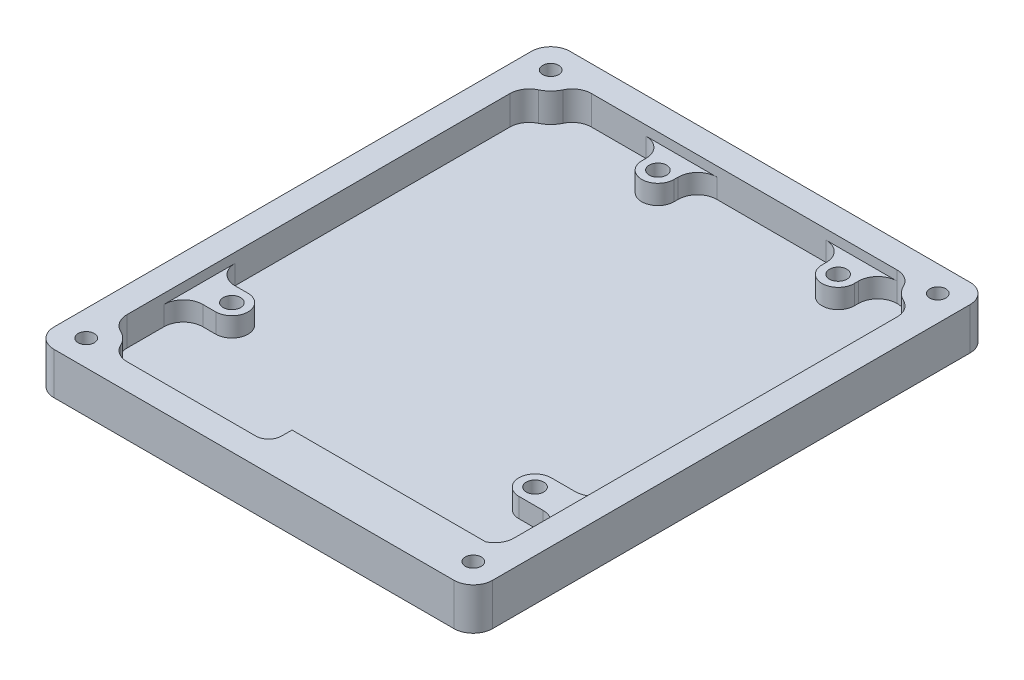
from build123d import *

# Parameters (mm, degrees)
EXTRUDE_1_DEPTH     = 7.5
EXTRUDE_2_DEPTH     = 3
EXTRUDE_3_DEPTH     = 3
FILLET_3_R          = 3
EXTRUDE_4_REACH     = 55.031
SKETCH_5_W          = 30
SKETCH_5_H          = 4.5
SKETCH_8_R          = 1.25
CUT_EXTRUDE_2_DEPTH = 5
CHAMFER_1_SIZE      = 1
CHAMFER_1_SIZE_2    = 3
CUT_EXTRUDE_4_DEPTH = 0.1
CUT_EXTRUDE_3_DEPTH = 0.2
SKETCH_20_R         = 1.35
CUT_EXTRUDE_5_DEPTH = 5
FILLET_4_R          = 2


with BuildPart() as part:
    # 스케치1 → 보스-돌출1 (new body)
    with BuildSketch(Plane(origin=(0, 0, 0), x_dir=(1, 0, 0), z_dir=(0, 1, 0))):
        with BuildLine():
            Line((-34, 37), (-34, -37))
            ThreePointArc((-34, -37), (-33.121320344, -39.121320344), (-31, -40))
            Line((-31, -40), (31, -40))
            ThreePointArc((31, -40), (33.121320344, -39.121320344), (34, -37))
            Line((34, -37), (34, 37))
            ThreePointArc((34, 37), (33.121320344, 39.121320344), (31, 40))
            Line((31, 40), (-31, 40))
            ThreePointArc((-31, 40), (-33.121320344, 39.121320344), (-34, 37))
        make_face()
        with BuildLine():
            Line((-26, 36), (26, 36))
            ThreePointArc((26, 36), (27.171572875, 33.171572875), (30, 32))
            Line((30, 32), (30, -32))
            ThreePointArc((30, -32), (27.171572875, -33.171572875), (26, -36))
            Line((26, -36), (-26, -36))
            ThreePointArc((-26, -36), (-27.171572875, -33.171572875), (-30, -32))
            Line((-30, -32), (-30, 32))
            ThreePointArc((-30, 32), (-27.171572875, 33.171572875), (-26, 36))
        make_face(mode=Mode.SUBTRACT)
    extrude(amount=EXTRUDE_1_DEPTH)

    # 스케치3 → 보스-돌출2 (add)
    with BuildSketch(Plane.XZ):
        with BuildLine():
            Line((-34, 37), (-34, -37))
            ThreePointArc((-34, -37), (-33.121320344, -39.121320344), (-31, -40))
            Line((-31, -40), (31, -40))
            ThreePointArc((31, -40), (33.121320344, -39.121320344), (34, -37))
            Line((34, -37), (34, 37))
            ThreePointArc((34, 37), (33.121320344, 39.121320344), (31, 40))
            Line((31, 40), (-31, 40))
            ThreePointArc((-31, 40), (-33.121320344, 39.121320344), (-34, 37))
        make_face()
    extrude(amount=-EXTRUDE_2_DEPTH)

    # 스케치4 → 보스-돌출3 (add)
    with BuildSketch(Plane(origin=(0, 3, 0), x_dir=(1, 0, 0), z_dir=(0, 1, 0))):
        with BuildLine():
            Line((23.27542024, -17.206647727), (31.27542024, -17.206647727))
            Line((31.27542024, -17.206647727), (31.27542024, -22.206647727))
            Line((31.27542024, -22.206647727), (23.27542024, -22.206647727))
            ThreePointArc((23.27542024, -22.206647727), (20.77542024, -19.706647727), (23.27542024, -17.206647727))
        make_face()
        with BuildLine():
            Line((-24.98457976, -20.936647727), (-30.98457976, -20.936647727))
            Line((-30.98457976, -20.936647727), (-30.98457976, -15.936647727))
            Line((-30.98457976, -15.936647727), (-24.98457976, -15.936647727))
            ThreePointArc((-24.98457976, -15.936647727), (-22.48457976, -18.436647727), (-24.98457976, -20.936647727))
        make_face()
        with BuildLine():
            Line((15.69542024, 32.363352273), (15.69542024, 38.363352273))
            Line((15.69542024, 38.363352273), (20.69542024, 38.363352273))
            Line((20.69542024, 38.363352273), (20.69542024, 32.363352273))
            ThreePointArc((20.69542024, 32.363352273), (18.19542024, 29.863352273), (15.69542024, 32.363352273))
        make_face()
        with BuildLine():
            Line((-12.24457976, 38.363352273), (-7.24457976, 38.363352273))
            Line((-7.24457976, 38.363352273), (-7.24457976, 32.363352273))
            ThreePointArc((-7.24457976, 32.363352273), (-9.74457976, 29.863352273), (-12.24457976, 32.363352273))
            Line((-12.24457976, 32.363352273), (-12.24457976, 38.363352273))
        make_face()
    extrude(amount=EXTRUDE_3_DEPTH)

    # 필렛3
    # the kernel refuses this fillet: 3 mm, written as the material it adds along each edge
    with BuildSketch(Plane(origin=(30, 3, 17.206647727), x_dir=(0, 0, -1), z_dir=(0, 1, 0)), Plane(origin=(30, 6, 22.206647727), x_dir=(0, 0, 1), z_dir=(0, -1, 0)), Plane(origin=(15.69542024, 3, -36), x_dir=(-1, 0, 0), z_dir=(0, 1, 0)), Plane(origin=(20.69542024, 6, -36), x_dir=(1, 0, 0), z_dir=(0, -1, 0)), Plane(origin=(-7.24457976, 6, -36), x_dir=(1, 0, 0), z_dir=(0, -1, 0)), Plane(origin=(-12.24457976, 3, -36), x_dir=(-1, 0, 0), z_dir=(0, 1, 0)), Plane(origin=(-30, 6, 15.936647727), x_dir=(0, 0, -1), z_dir=(0, -1, 0)), Plane(origin=(-30, 3, 20.936647727), x_dir=(0, 0, 1), z_dir=(0, 1, 0))) as fillet_3_piece_1:
        with BuildLine():
            CenterArc((FILLET_3_R, FILLET_3_R), FILLET_3_R, 180, 90)
            Line((0, FILLET_3_R), (0, 0))
            Line((0, 0), (FILLET_3_R, 0))
        make_face()
    extrude(amount=3)
    with BuildSketch(Plane(origin=(30, 3, -32), x_dir=(-0.9755787776764236, 0, -0.21964983165797128), z_dir=(0, 1, 0)), Plane(origin=(-30, 3, 32), x_dir=(0.9755787776764236, 0, 0.21964983165797128), z_dir=(0, 1, 0)), Plane(origin=(26, 3, 36), x_dir=(0.21964983165797042, 0, -0.9755787776764239), z_dir=(0, 1, 0))) as fillet_3_piece_2:
        with BuildLine():
            CenterArc((2.416148148, 2.926736333), FILLET_3_R, 192.688466763, 64.623066475)
            Line((-0.510588185, 2.267786838), (0, 0))
            ThreePointArc((0, 0), (0.878599327, 0.097684889), (1.757198653, 0))
        make_face()
    extrude(amount=4.5)
    with BuildSketch(Plane(origin=(26, 3, -36), x_dir=(-1, 0, 0), z_dir=(0, 1, 0)), Plane(origin=(-30, 3, -32), x_dir=(0, 0, 1), z_dir=(0, 1, 0)), Plane(origin=(-26, 3, 36), x_dir=(1, 0, 0), z_dir=(0, 1, 0)), Plane(origin=(30, 3, 32), x_dir=(0, 0, -1), z_dir=(0, 1, 0))) as fillet_3_piece_3:
        with BuildLine():
            CenterArc((2.32455532, 3), FILLET_3_R, 205.376933525, 64.623066475)
            ThreePointArc((-0.385968388, 1.714285714), (-0.097684889, 0.878599327), (0, 0))
            Line((0, 0), (2.32455532, 0))
        make_face()
    extrude(amount=4.5)
    with BuildSketch(Plane(origin=(-26, 3, -36), x_dir=(1, 0, 0), z_dir=(0, 1, 0))) as fillet_3_piece_4:
        with BuildLine():
            CenterArc((2.32455532, -3), FILLET_3_R, 90, 64.623066475)
            ThreePointArc((-0.385968388, -1.714285714), (-0.097684889, -0.878599327), (0, 0))
            Line((0, 0), (2.32455532, 0))
        make_face()
    extrude(amount=4.5)

    # 스케치5 → 보스-돌출4 (add, up to next)
    with BuildSketch(Plane(origin=(0, 7.5, 0), x_dir=(1, 0, 0), z_dir=(0, 1, 0)), mode=Mode.PRIVATE) as extrude_4_sk1:
        with Locations((13.285714286, -34.635968388)):
            Rectangle(SKETCH_5_W, SKETCH_5_H)
    extrude_4_tool1 = extrude(extrude_4_sk1.sketch, amount=-EXTRUDE_4_REACH, mode=Mode.PRIVATE) - part.part
    add(extrude_4_tool1.solids().sort_by_distance((13.285714, 7.5, 34.635968))[0])

    # 스케치8 → 컷-돌출2 (cut)
    with BuildSketch(Plane(origin=(0, 7.5, 0), x_dir=(1, 0, 0), z_dir=(0, 1, 0))):
        with Locations(Location((30, -36, 0), (0, 0, 270))):
            Circle(SKETCH_8_R)
        with Locations(Location((-30, -36, 0), (0, 0, 90))):
            Circle(SKETCH_8_R)
        with Locations(Location((-30, 36, 0), (0, 0, 270))):
            Circle(SKETCH_8_R)
        with Locations(Location((30, 36, 0), (0, 0, 90))):
            Circle(SKETCH_8_R)
    extrude(amount=-CUT_EXTRUDE_2_DEPTH, mode=Mode.SUBTRACT)

    # 모따기1
    # the kernel refuses this chamfer: 3, 1 mm, written as the material it takes off along each edge
    with BuildSketch(Plane(origin=(-31, 0, 40), x_dir=(0, 1, 0), z_dir=(1, 0, 0)), Plane(origin=(31, 0, -40), x_dir=(0, 1, 0), z_dir=(-1, 0, 0))) as chamfer_1_piece_1:
        Polygon((CHAMFER_1_SIZE, 0), (0, -CHAMFER_1_SIZE_2), (0, 0), align=None)
    extrude(amount=62, mode=Mode.SUBTRACT)
    with BuildSketch(Plane(origin=(-31, 0, 37), x_dir=(-1, 0, 0), z_dir=(0, 0, -1))) as chamfer_1_piece_2:
        Polygon((3, CHAMFER_1_SIZE), (3 - CHAMFER_1_SIZE_2, 0), (3, 0), align=None)
    revolve(axis=Axis((-31, 0, 37), (0, 1, 0)), revolution_arc=90, mode=Mode.SUBTRACT)
    with BuildSketch(Plane(origin=(-34, 0, -37), x_dir=(0, 1, 0), z_dir=(0, 0, 1)), Plane(origin=(34, 0, 37), x_dir=(0, 1, 0), z_dir=(0, 0, -1))) as chamfer_1_piece_3:
        Polygon((CHAMFER_1_SIZE, 0), (0, -CHAMFER_1_SIZE_2), (0, 0), align=None)
    extrude(amount=74, mode=Mode.SUBTRACT)
    with BuildSketch(Plane(origin=(-31, 0, -37), x_dir=(0, 0, -1), z_dir=(1, 0, 0))) as chamfer_1_piece_4:
        Polygon((3, CHAMFER_1_SIZE), (3 - CHAMFER_1_SIZE_2, 0), (3, 0), align=None)
    revolve(axis=Axis((-31, 0, -37), (0, 1, 0)), revolution_arc=90, mode=Mode.SUBTRACT)
    with BuildSketch(Plane(origin=(31, 0, -37), x_dir=(1, 0, 0), z_dir=(0, 0, 1))) as chamfer_1_piece_5:
        Polygon((3, CHAMFER_1_SIZE), (3 - CHAMFER_1_SIZE_2, 0), (3, 0), align=None)
    revolve(axis=Axis((31, 0, -37), (0, 1, 0)), revolution_arc=90, mode=Mode.SUBTRACT)
    with BuildSketch(Plane(origin=(31, 0, 37), x_dir=(0, 0, 1), z_dir=(-1, 0, 0))) as chamfer_1_piece_6:
        Polygon((3, CHAMFER_1_SIZE), (3 - CHAMFER_1_SIZE_2, 0), (3, 0), align=None)
    revolve(axis=Axis((31, 0, 37), (0, 1, 0)), revolution_arc=90, mode=Mode.SUBTRACT)

    # 스케치19 → 컷-돌출4 (cut)
    with BuildSketch(Plane.XZ):
        with BuildLine():
            Line((-21.644118146, 40), (-26.644118146, 40))
            Line((-26.644118146, 40), (-26.644118146, -18))
            ThreePointArc((-26.644118146, -18), (-27.229904584, -19.414213562), (-28.644118146, -20))
            Line((-28.644118146, -20), (-34, -20))
            Line((-34, -20), (-34, -25))
            Line((-34, -25), (-28.644118146, -25))
            ThreePointArc((-28.644118146, -25), (-27.229904584, -25.585786438), (-26.644118146, -27))
            Line((-26.644118146, -27), (-26.644118146, -40))
            Line((-26.644118146, -40), (-21.644118146, -40))
            Line((-21.644118146, -40), (-21.644118146, -27))
            ThreePointArc((-21.644118146, -27), (-21.058331708, -25.585786438), (-19.644118146, -25))
            Line((-19.644118146, -25), (34, -25))
            Line((34, -25), (34, -20))
            Line((34, -20), (-19.644118146, -20))
            ThreePointArc((-19.644118146, -20), (-21.058331708, -19.414213562), (-21.644118146, -18))
            Line((-21.644118146, -18), (-21.644118146, 40))
        make_face()
    extrude(amount=-CUT_EXTRUDE_4_DEPTH, mode=Mode.SUBTRACT)

    # 스케치17 → 컷-돌출3 (cut)
    # profile 1 of 10: a face of its own
    with BuildSketch(Plane.XZ):
        Polygon((28.940006813, -34.5), (28.162963544, -34.5), (26.574622198, -31.538762019), (26.574622198, -34.5), (25.824622198, -34.5), (25.824622198, -30), (26.606172678, -30), (28.190006813, -32.952223558), (28.190006813, -30), (28.940006813, -30), align=None)
    # profile 2 of 10: a face of its own
    with BuildSketch(Plane.XZ):
        Polygon((24.532314505, -34.5), (22.455391428, -34.5), (22.455391428, -33.692307692), (23.782314505, -33.692307692), (23.782314505, -32.826923077), (22.455391428, -32.826923077), (22.455391428, -32.019230769), (23.782314505, -32.019230769), (23.782314505, -30.807692308), (22.455391428, -30.807692308), (22.455391428, -30), (24.532314505, -30), align=None)
    # profile 3 of 10: a face of its own
    with BuildSketch(Plane.XZ):
        Polygon((21.618312101, -34.5), (20.72317989, -34.5), (19.892050082, -33.054987981), (19.05911739, -34.5), (18.163083736, -34.5), (19.444033255, -32.277043269), (18.134237582, -30), (19.030271236, -30), (19.892951524, -31.499098558), (20.756533255, -30), (21.653468351, -30), (20.340066909, -32.277944712), align=None)
    # profile 4 of 10: a face of its own
    with BuildSketch(Plane.XZ):
        with BuildLine():
            add(Edge.make_bspline(
                [(15.420355371, -34.615384615), (15.352611012, -34.613385577), (15.219028568, -34.609443751), (15.022436315, -34.575658307), (14.833064802, -34.521625061), (14.650773906, -34.445576931), (14.476803635, -34.346650147), (14.308815472, -34.228494986), (14.150044228, -34.085954053), (13.999192192, -33.925488373), (13.861267224, -33.748990944), (13.740048193, -33.561140921), (13.63740953, -33.36356384), (13.554620182, -33.156218847), (13.489367206, -32.939654577), (13.44273301, -32.713759656), (13.413977935, -32.478209836), (13.410836057, -32.317991624), (13.409237582, -32.236478365)],
                knots=[0, 0, 0, 0, 0.939701192, 1.852959929, 2.759806468, 3.668339274, 4.587066675, 5.532460757, 6.513305242, 7.543018997, 8.585858139, 9.617757006, 10.64181351, 11.671054199, 12.71205706, 13.777003075, 14.869019183, 16, 16, 16, 16], degree=3))
            add(Edge.make_bspline(
                [(13.409237582, -32.236478365), (13.410804475, -32.155858915), (13.413889588, -31.997124326), (13.443151398, -31.764189758), (13.487467299, -31.540181746), (13.55151156, -31.325759046), (13.635102811, -31.121551318), (13.735368969, -30.926168162), (13.855241405, -30.740987294), (13.991080557, -30.566435895), (14.140125226, -30.40738106), (14.298346603, -30.267090393), (14.465383034, -30.149238323), (14.639628502, -30.051673883), (14.822904409, -29.977789559), (15.01295673, -29.922801165), (15.211652971, -29.890977091), (15.346627347, -29.886753314), (15.414946717, -29.884615385)],
                knots=[0, 0, 0, 0, 1.125583416, 2.216202432, 3.273892453, 4.312262039, 5.336368686, 6.351890797, 7.375214529, 8.412896844, 9.437287257, 10.415660535, 11.361210459, 12.28739245, 13.198493298, 14.115135734, 15.045946767, 16, 16, 16, 16], degree=3))
            add(Edge.make_bspline(
                [(15.414946717, -29.884615385), (15.486607994, -29.88649518), (15.627432598, -29.890189244), (15.833441706, -29.925268739), (16.030658494, -29.978724996), (16.218441983, -30.05587069), (16.396207556, -30.156175487), (16.564781587, -30.27786533), (16.723943862, -30.421430695), (16.872301363, -30.584333124), (17.005912361, -30.762881121), (17.12538843, -30.950502984), (17.223891128, -31.148054275), (17.307262717, -31.352528541), (17.369807794, -31.565931803), (17.415013851, -31.78721734), (17.442685999, -32.016724262), (17.446012218, -32.172699515), (17.447699121, -32.251802885)],
                knots=[0, 0, 0, 0, 0.990069867, 1.945628152, 2.881021802, 3.81072366, 4.744519711, 5.696947768, 6.679597606, 7.703032787, 8.738381989, 9.759664478, 10.774155271, 11.786372039, 12.809098599, 13.843905817, 14.906529641, 16, 16, 16, 16], degree=3))
            add(Edge.make_bspline(
                [(17.447699121, -32.251802885), (17.446785342, -32.305013955), (17.44497073, -32.410682334), (17.431909645, -32.567445235), (17.411652483, -32.721050425), (17.381479054, -32.871135037), (17.343577082, -33.018284248), (17.297930566, -33.162715055), (17.242596051, -33.303405157), (17.179704134, -33.440050067), (17.109603189, -33.571803282), (17.031987117, -33.696695417), (16.949052977, -33.815308864), (16.859684554, -33.926790041), (16.762974603, -34.030093441), (16.660659295, -34.127442784), (16.551641138, -34.217098987), (16.437646733, -34.300244058), (16.318596116, -34.373717741), (16.19735325, -34.439029224), (16.073303038, -34.493201309), (15.947273148, -34.537385153), (15.819192827, -34.573327093), (15.688124955, -34.596715562), (15.555098164, -34.613372875), (15.465480461, -34.614710888), (15.420355371, -34.615384615)],
                knots=[0, 0, 0, 0, 1.108094103, 2.200491474, 3.274030703, 4.333173653, 5.386532743, 6.437435233, 7.485651228, 8.532876709, 9.568747168, 10.591625577, 11.593381926, 12.5814601, 13.564452017, 14.538318241, 15.520652592, 16.502029696, 17.474487464, 18.431949576, 19.367901306, 20.290218004, 21.211748856, 22.134744664, 23.060790306, 24, 24, 24, 24], degree=3))
        make_face()
        with BuildLine():
            add(Edge.make_bspline(
                [(15.431172678, -33.807692308), (15.475129497, -33.806294925), (15.561737738, -33.803541658), (15.688721299, -33.782068786), (15.810565465, -33.748106721), (15.926564538, -33.698774993), (16.037189686, -33.636119341), (16.142579918, -33.5598172), (16.241767658, -33.468904576), (16.334938119, -33.365621896), (16.420087504, -33.252076969), (16.494438759, -33.129394846), (16.557420001, -32.999607481), (16.609348289, -32.862415936), (16.648668525, -32.717405134), (16.677374046, -32.565229035), (16.694978658, -32.405462671), (16.696778919, -32.296620277), (16.697699121, -32.240985577)],
                knots=[0, 0, 0, 0, 0.938984912, 1.850084528, 2.744533622, 3.636674457, 4.536753769, 5.456480413, 6.411145192, 7.406850971, 8.425344542, 9.439679364, 10.467884799, 11.504359312, 12.569986249, 13.674549399, 14.811347848, 16, 16, 16, 16], degree=3))
            add(Edge.make_bspline(
                [(16.697699121, -32.240985577), (16.696359859, -32.179325485), (16.693738029, -32.058615495), (16.671944667, -31.882643363), (16.635551041, -31.716537116), (16.58679322, -31.559824738), (16.521241999, -31.413640763), (16.4412627, -31.278038689), (16.348605465, -31.150716964), (16.275016709, -31.076055054), (16.237963544, -31.038461538)],
                knots=[0, 0, 0, 0, 1.117094982, 2.186901094, 3.206880241, 4.195341985, 5.155672878, 6.102619309, 7.04463721, 8, 8, 8, 8], degree=3))
            add(Edge.make_bspline(
                [(16.237963544, -31.038461538), (16.208115963, -31.010825419), (16.149409199, -30.956468345), (16.054196766, -30.886408218), (15.956445123, -30.826144197), (15.854952194, -30.777207775), (15.750108333, -30.739250349), (15.642016472, -30.712084683), (15.530854409, -30.695373611), (15.455569131, -30.693334639), (15.417651044, -30.692307692)],
                knots=[0, 0, 0, 0, 1.067795346, 2.10023084, 3.099268521, 4.080689547, 5.05446302, 6.02313674, 7.004335556, 8, 8, 8, 8], degree=3))
            add(Edge.make_bspline(
                [(15.417651044, -30.692307692), (15.374902607, -30.693740979), (15.290399995, -30.696574216), (15.165926705, -30.717742062), (15.046546053, -30.753148567), (14.93142018, -30.80198764), (14.822663844, -30.866824294), (14.717817092, -30.944029343), (14.618411704, -31.035898186), (14.52502875, -31.140652529), (14.438692266, -31.25466378), (14.364767269, -31.377896658), (14.300259339, -31.506160068), (14.24907016, -31.642016249), (14.207667682, -31.783786097), (14.181243653, -31.932866302), (14.1615501, -32.087820671), (14.160018501, -32.193442257), (14.159237582, -32.247295673)],
                knots=[0, 0, 0, 0, 0.923045963, 1.824623341, 2.717916812, 3.607595847, 4.51809903, 5.446196334, 6.415386555, 7.435664212, 8.474069372, 9.49918635, 10.535358159, 11.570716647, 12.63068019, 13.720271369, 14.837631782, 16, 16, 16, 16], degree=3))
            add(Edge.make_bspline(
                [(14.159237582, -32.247295673), (14.160063105, -32.300841471), (14.161686638, -32.406148575), (14.180835442, -32.560659737), (14.208885637, -32.708887004), (14.250096499, -32.850851802), (14.302168668, -32.986581647), (14.365337671, -33.116786251), (14.441769872, -33.239307067), (14.527571172, -33.355159895), (14.62201503, -33.460561881), (14.722710958, -33.55298333), (14.827349192, -33.633002086), (14.939047901, -33.695539347), (15.054779174, -33.746236754), (15.175756897, -33.782413515), (15.302136222, -33.803381321), (15.387826713, -33.80624416), (15.431172678, -33.807692308)],
                knots=[0, 0, 0, 0, 1.148768439, 2.259252506, 3.337016357, 4.384257863, 5.427598867, 6.454541826, 7.485588571, 8.522770577, 9.545877973, 10.518217302, 11.453480635, 12.366322478, 13.259002155, 14.161000873, 15.069754509, 16, 16, 16, 16], degree=3))
        make_face(mode=Mode.SUBTRACT)
    # profile 5 of 10: a face of its own
    with BuildSketch(Plane.XZ):
        Polygon((12.290006813, -34.5), (11.512963544, -34.5), (9.924622198, -31.538762019), (9.924622198, -34.5), (9.174622198, -34.5), (9.174622198, -30), (9.956172678, -30), (11.540006813, -32.952223558), (11.540006813, -30), (12.290006813, -30), align=None)
    # profile 6 of 10: a face of its own
    with BuildSketch(Plane.XZ):
        Polygon((7.882314505, -34.5), (5.805391428, -34.5), (5.805391428, -33.692307692), (7.132314505, -33.692307692), (7.132314505, -32.826923077), (5.805391428, -32.826923077), (5.805391428, -32.019230769), (7.132314505, -32.019230769), (7.132314505, -30.807692308), (5.805391428, -30.807692308), (5.805391428, -30), (7.882314505, -30), align=None)
    # profile 7 of 10: a face of its own
    with BuildSketch(Plane.XZ):
        with BuildLine():
            Line((1.16692989, -33.719350962), (1.669934698, -33.153245192))
            add(Edge.make_bspline(
                [(1.669934698, -33.153245192), (1.712653017, -33.205081029), (1.795522584, -33.30563773), (1.930023249, -33.439500693), (2.068955497, -33.552984646), (2.212604708, -33.644919873), (2.359643675, -33.718684771), (2.511270444, -33.77007827), (2.667066698, -33.80231457), (2.772544604, -33.805892939), (2.825583736, -33.807692308)],
                knots=[0, 0, 0, 0, 1.170510703, 2.270681886, 3.30236958, 4.291968477, 5.238462851, 6.162866624, 7.076205018, 8, 8, 8, 8], degree=3))
            add(Edge.make_bspline(
                [(2.825583736, -33.807692308), (2.869828334, -33.806244132), (2.957305643, -33.803380902), (3.085729363, -33.782517512), (3.208613657, -33.746723297), (3.326192454, -33.698214228), (3.438231967, -33.63497987), (3.545046324, -33.558319742), (3.645182466, -33.465902138), (3.740193024, -33.362099092), (3.826668763, -33.248120661), (3.902097171, -33.126028212), (3.966535393, -32.997686958), (4.018465595, -32.862291603), (4.059587129, -32.720608326), (4.087640391, -32.57237777), (4.10678835, -32.417867514), (4.108412, -32.312560285), (4.109237582, -32.259014423)],
                knots=[0, 0, 0, 0, 0.948430614, 1.875170335, 2.780455941, 3.687344756, 4.595925315, 5.532820415, 6.499649097, 7.511983935, 8.54664231, 9.56210869, 10.584905582, 11.620987023, 12.666975714, 13.743450237, 14.852605832, 16, 16, 16, 16], degree=3))
            add(Edge.make_bspline(
                [(4.109237582, -32.259014423), (4.107607244, -32.184968152), (4.104423506, -32.040369925), (4.071651728, -31.830453746), (4.020966465, -31.632988271), (3.94838037, -31.449957492), (3.859044058, -31.281340683), (3.750130801, -31.131710783), (3.624576158, -31.000762088), (3.505668162, -30.909723876), (3.405427163, -30.845330988), (3.326380328, -30.805393649), (3.246489317, -30.769451199), (3.163515288, -30.741978678), (3.079145926, -30.718753363), (2.992110016, -30.704274355), (2.903387956, -30.693276249), (2.843348501, -30.692633152), (2.812963544, -30.692307692)],
                knots=[0, 0, 0, 0, 1.562732084, 3.051717324, 4.475565403, 5.860279792, 7.200461323, 8.495231832, 9.756407949, 11.018222588, 11.648547135, 12.270153614, 12.886816305, 13.496912979, 14.114195809, 14.732912363, 15.358748275, 16, 16, 16, 16], degree=3))
            add(Edge.make_bspline(
                [(2.812963544, -30.692307692), (2.761772203, -30.694069938), (2.660812652, -30.697545438), (2.512884454, -30.724220162), (2.371674359, -30.768658107), (2.25963962, -30.821191296), (2.171985146, -30.872562943), (2.105158214, -30.919111227), (2.036601325, -30.972421557), (1.966364834, -31.033055205), (1.893912383, -31.100754663), (1.820730036, -31.176685115), (1.744520533, -31.258373657), (1.695225711, -31.316785995), (1.669934698, -31.346754808)],
                knots=[0, 0, 0, 0, 1.347336849, 2.657217438, 3.943371235, 5.235328007, 5.905642973, 6.616696394, 7.377920128, 8.191455246, 9.059055622, 9.987811975, 10.967634451, 12, 12, 12, 12], degree=3))
            Line((1.669934698, -31.346754808), (1.182254409, -30.743689904))
            add(Edge.make_bspline(
                [(1.182254409, -30.743689904), (1.216823442, -30.704665782), (1.284367865, -30.628416564), (1.387857537, -30.521392626), (1.490278052, -30.423556428), (1.590638745, -30.334394788), (1.689736518, -30.254676084), (1.787755867, -30.185350444), (1.882892325, -30.123118622), (1.97886127, -30.071583721), (2.075326586, -30.026577165), (2.174716057, -29.989239719), (2.277058798, -29.956004412), (2.383023318, -29.930749822), (2.492068902, -29.909210481), (2.604464505, -29.895555567), (2.720244387, -29.885831383), (2.798518988, -29.885024481), (2.838203928, -29.884615385)],
                knots=[0, 0, 0, 0, 1.292889521, 2.526176407, 3.691075236, 4.805087549, 5.854906529, 6.843390799, 7.781927809, 8.672302194, 9.542582652, 10.420076512, 11.303908427, 12.20946698, 13.120040823, 14.059198978, 15.016020894, 16, 16, 16, 16], degree=3))
            add(Edge.make_bspline(
                [(2.838203928, -29.884615385), (2.910720795, -29.88678815), (3.053110153, -29.89105445), (3.261569194, -29.921818215), (3.459746569, -29.974645548), (3.648105365, -30.047566095), (3.826072112, -30.142314513), (3.993796189, -30.257303109), (4.150438541, -30.394220679), (4.296578374, -30.549162208), (4.428341067, -30.72100995), (4.544698492, -30.905634841), (4.641923599, -31.102817088), (4.721420317, -31.311472582), (4.783849587, -31.531312176), (4.827609749, -31.762994272), (4.854099674, -32.006293013), (4.857501113, -32.172408111), (4.859237582, -32.257211538)],
                knots=[0, 0, 0, 0, 0.996862199, 1.957373176, 2.88931343, 3.811468658, 4.728119874, 5.655157513, 6.601103124, 7.583070177, 8.578776048, 9.573710286, 10.578782373, 11.596141531, 12.639719139, 13.716515457, 14.834258185, 16, 16, 16, 16], degree=3))
            add(Edge.make_bspline(
                [(4.859237582, -32.257211538), (4.85872304, -32.312528189), (4.857703739, -32.422109565), (4.844208758, -32.58391375), (4.82489949, -32.741053301), (4.797005672, -32.893470944), (4.759802123, -33.040762921), (4.715788125, -33.183895869), (4.663350629, -33.322070467), (4.603212612, -33.45518723), (4.535224596, -33.582707682), (4.460817119, -33.704417846), (4.378401309, -33.819377445), (4.288608036, -33.927490242), (4.193496275, -34.030760454), (4.090088515, -34.126468568), (3.979970352, -34.215611788), (3.864036229, -34.298516024), (3.743439424, -34.372984022), (3.619201964, -34.436867762), (3.493423395, -34.49264244), (3.364752297, -34.53777383), (3.23340325, -34.571586133), (3.100476646, -34.597589149), (2.964715265, -34.611807806), (2.873389839, -34.614186433), (2.827386621, -34.615384615)],
                knots=[0, 0, 0, 0, 1.147936384, 2.274043118, 3.367975722, 4.433534104, 5.487934883, 6.519733941, 7.540311277, 8.553619997, 9.549755866, 10.538207322, 11.512706082, 12.483024012, 13.453963202, 14.424902393, 15.404875068, 16.393149396, 17.381600852, 18.344048463, 19.290846801, 20.235732517, 21.170684427, 22.104053788, 23.044957894, 24, 24, 24, 24], degree=3))
            add(Edge.make_bspline(
                [(2.827386621, -34.615384615), (2.788297327, -34.614703115), (2.71027039, -34.613342759), (2.593787072, -34.601978397), (2.478295751, -34.584540241), (2.364224845, -34.557439137), (2.250847291, -34.525499437), (2.138592541, -34.485972022), (2.028524983, -34.437135783), (1.918660866, -34.38395648), (1.81172955, -34.32240848), (1.707907702, -34.255086227), (1.608448526, -34.180402775), (1.512237636, -34.100632295), (1.419858142, -34.014529859), (1.331497727, -33.922356527), (1.246404499, -33.824131075), (1.193596126, -33.754507992), (1.16692989, -33.719350962)],
                knots=[0, 0, 0, 0, 0.957930388, 1.912144391, 2.866329968, 3.818609135, 4.783760774, 5.752838773, 6.732522403, 7.733865924, 8.743329637, 9.754538319, 10.765049375, 11.790110876, 12.816732331, 13.858538565, 14.918642741, 16, 16, 16, 16], degree=3))
        make_face()
    # profile 8 of 10: a face of its own
    with BuildSketch(Plane.XZ):
        with BuildLine():
            add(Edge.make_bspline(
                [(-1.806567706, -34.615384615), (-1.874312065, -34.613385577), (-2.007894509, -34.609443751), (-2.204486762, -34.575658307), (-2.393858275, -34.521625061), (-2.576149171, -34.445576931), (-2.750119442, -34.346650147), (-2.918107605, -34.228494986), (-3.076878849, -34.085954053), (-3.227730885, -33.925488373), (-3.365655853, -33.748990944), (-3.486874884, -33.561140921), (-3.589513547, -33.36356384), (-3.672302895, -33.156218847), (-3.73755587, -32.939654577), (-3.784190067, -32.713759656), (-3.812945142, -32.478209836), (-3.81608702, -32.317991624), (-3.817685495, -32.236478365)],
                knots=[0, 0, 0, 0, 0.939701192, 1.852959929, 2.759806468, 3.668339274, 4.587066675, 5.532460757, 6.513305242, 7.543018997, 8.585858139, 9.617757006, 10.64181351, 11.671054199, 12.71205706, 13.777003075, 14.869019183, 16, 16, 16, 16], degree=3))
            add(Edge.make_bspline(
                [(-3.817685495, -32.236478365), (-3.816118602, -32.155858915), (-3.813033489, -31.997124326), (-3.783771678, -31.764189758), (-3.739455778, -31.540181746), (-3.675411517, -31.325759046), (-3.591820266, -31.121551318), (-3.491554107, -30.926168162), (-3.371681672, -30.740987294), (-3.23584252, -30.566435895), (-3.086797851, -30.40738106), (-2.928576474, -30.267090393), (-2.761540043, -30.149238323), (-2.587294575, -30.051673883), (-2.404018668, -29.977789559), (-2.213966347, -29.922801165), (-2.015270106, -29.890977091), (-1.88029573, -29.886753314), (-1.81197636, -29.884615385)],
                knots=[0, 0, 0, 0, 1.125583416, 2.216202432, 3.273892453, 4.312262039, 5.336368686, 6.351890797, 7.375214529, 8.412896844, 9.437287257, 10.415660535, 11.361210459, 12.28739245, 13.198493298, 14.115135734, 15.045946767, 16, 16, 16, 16], degree=3))
            add(Edge.make_bspline(
                [(-1.81197636, -29.884615385), (-1.740315083, -29.88649518), (-1.599490478, -29.890189244), (-1.39348137, -29.925268739), (-1.196264583, -29.978724996), (-1.008481093, -30.05587069), (-0.830715521, -30.156175487), (-0.66214149, -30.27786533), (-0.502979215, -30.421430695), (-0.354621714, -30.584333124), (-0.221010716, -30.762881121), (-0.101534647, -30.950502984), (-0.003031949, -31.148054275), (0.080339641, -31.352528541), (0.142884717, -31.565931803), (0.188090774, -31.78721734), (0.215762922, -32.016724262), (0.219089141, -32.172699515), (0.220776044, -32.251802885)],
                knots=[0, 0, 0, 0, 0.990069867, 1.945628152, 2.881021802, 3.81072366, 4.744519711, 5.696947768, 6.679597606, 7.703032787, 8.738381989, 9.759664478, 10.774155271, 11.786372039, 12.809098599, 13.843905817, 14.906529641, 16, 16, 16, 16], degree=3))
            add(Edge.make_bspline(
                [(0.220776044, -32.251802885), (0.219862266, -32.305013955), (0.218047654, -32.410682334), (0.204986568, -32.567445235), (0.184729406, -32.721050425), (0.154555977, -32.871135037), (0.116654005, -33.018284248), (0.071007489, -33.162715055), (0.015672975, -33.303405157), (-0.047218943, -33.440050067), (-0.117319888, -33.571803282), (-0.19493596, -33.696695417), (-0.2778701, -33.815308864), (-0.367238523, -33.926790041), (-0.463948474, -34.030093441), (-0.566263782, -34.127442784), (-0.675281939, -34.217098987), (-0.789276344, -34.300244058), (-0.908326961, -34.373717741), (-1.029569827, -34.439029224), (-1.153620039, -34.493201309), (-1.279649929, -34.537385153), (-1.407730249, -34.573327093), (-1.538798122, -34.596715562), (-1.671824913, -34.613372875), (-1.761442616, -34.614710888), (-1.806567706, -34.615384615)],
                knots=[0, 0, 0, 0, 1.108094103, 2.200491474, 3.274030703, 4.333173653, 5.386532743, 6.437435233, 7.485651228, 8.532876709, 9.568747168, 10.591625577, 11.593381926, 12.5814601, 13.564452017, 14.538318241, 15.520652592, 16.502029696, 17.474487464, 18.431949576, 19.367901306, 20.290218004, 21.211748856, 22.134744664, 23.060790306, 24, 24, 24, 24], degree=3))
        make_face()
        with BuildLine():
            add(Edge.make_bspline(
                [(-1.795750399, -33.807692308), (-1.751793579, -33.806294925), (-1.665185339, -33.803541658), (-1.538201778, -33.782068786), (-1.416357611, -33.748106721), (-1.300358539, -33.698774993), (-1.189733391, -33.636119341), (-1.084343159, -33.5598172), (-0.985155418, -33.468904576), (-0.891984958, -33.365621896), (-0.806835573, -33.252076969), (-0.732484318, -33.129394846), (-0.669503075, -32.999607481), (-0.617574788, -32.862415936), (-0.578254552, -32.717405134), (-0.549549031, -32.565229035), (-0.531944419, -32.405462671), (-0.530144158, -32.296620277), (-0.529223956, -32.240985577)],
                knots=[0, 0, 0, 0, 0.938984912, 1.850084528, 2.744533622, 3.636674457, 4.536753769, 5.456480413, 6.411145192, 7.406850971, 8.425344542, 9.439679364, 10.467884799, 11.504359312, 12.569986249, 13.674549399, 14.811347848, 16, 16, 16, 16], degree=3))
            add(Edge.make_bspline(
                [(-0.529223956, -32.240985577), (-0.530563218, -32.179325485), (-0.533185048, -32.058615495), (-0.55497841, -31.882643363), (-0.591372036, -31.716537116), (-0.640129857, -31.559824738), (-0.705681078, -31.413640763), (-0.785660377, -31.278038689), (-0.878317612, -31.150716964), (-0.951906368, -31.076055054), (-0.988959533, -31.038461538)],
                knots=[0, 0, 0, 0, 1.117094982, 2.186901094, 3.206880241, 4.195341985, 5.155672878, 6.102619309, 7.04463721, 8, 8, 8, 8], degree=3))
            add(Edge.make_bspline(
                [(-0.988959533, -31.038461538), (-1.018807114, -31.010825419), (-1.077513878, -30.956468345), (-1.172726311, -30.886408218), (-1.270477954, -30.826144197), (-1.371970883, -30.777207775), (-1.476814744, -30.739250349), (-1.584906605, -30.712084683), (-1.696068668, -30.695373611), (-1.771353946, -30.693334639), (-1.809272033, -30.692307692)],
                knots=[0, 0, 0, 0, 1.067795346, 2.10023084, 3.099268521, 4.080689547, 5.05446302, 6.02313674, 7.004335556, 8, 8, 8, 8], degree=3))
            add(Edge.make_bspline(
                [(-1.809272033, -30.692307692), (-1.85202047, -30.693740979), (-1.936523082, -30.696574216), (-2.060996372, -30.717742062), (-2.180377024, -30.753148567), (-2.295502897, -30.80198764), (-2.404259233, -30.866824294), (-2.509105985, -30.944029343), (-2.608511373, -31.035898186), (-2.701894327, -31.140652529), (-2.788230811, -31.25466378), (-2.862155808, -31.377896658), (-2.926663738, -31.506160068), (-2.977852917, -31.642016249), (-3.019255395, -31.783786097), (-3.045679424, -31.932866302), (-3.065372977, -32.087820671), (-3.066904576, -32.193442257), (-3.067685495, -32.247295673)],
                knots=[0, 0, 0, 0, 0.923045963, 1.824623341, 2.717916812, 3.607595847, 4.51809903, 5.446196334, 6.415386555, 7.435664212, 8.474069372, 9.49918635, 10.535358159, 11.570716647, 12.63068019, 13.720271369, 14.837631782, 16, 16, 16, 16], degree=3))
            add(Edge.make_bspline(
                [(-3.067685495, -32.247295673), (-3.066859972, -32.300841471), (-3.065236439, -32.406148575), (-3.046087635, -32.560659737), (-3.01803744, -32.708887004), (-2.976826578, -32.850851802), (-2.924754409, -32.986581647), (-2.861585406, -33.116786251), (-2.785153205, -33.239307067), (-2.699351904, -33.355159895), (-2.604908047, -33.460561881), (-2.504212119, -33.55298333), (-2.399573885, -33.633002086), (-2.287875176, -33.695539347), (-2.172143903, -33.746236754), (-2.05116618, -33.782413515), (-1.924786855, -33.803381321), (-1.839096364, -33.80624416), (-1.795750399, -33.807692308)],
                knots=[0, 0, 0, 0, 1.148768439, 2.259252506, 3.337016357, 4.384257863, 5.427598867, 6.454541826, 7.485588571, 8.522770577, 9.545877973, 10.518217302, 11.453480635, 12.366322478, 13.259002155, 14.161000873, 15.069754509, 16, 16, 16, 16], degree=3))
        make_face(mode=Mode.SUBTRACT)
    # profile 9 of 10: a face of its own
    with BuildSketch(Plane.XZ):
        with BuildLine():
            Line((-4.936916264, -34.5), (-5.741002802, -34.5))
            add(Edge.make_bspline(
                [(-5.741002802, -34.5), (-5.793896163, -34.499772786), (-5.896118211, -34.499333671), (-6.04339664, -34.492660946), (-6.179081526, -34.483405822), (-6.302617459, -34.468715529), (-6.414465088, -34.451554451), (-6.514239608, -34.428550572), (-6.602727119, -34.403513728), (-6.703844182, -34.362226326), (-6.817651639, -34.298237946), (-6.937163424, -34.197658124), (-7.045414456, -34.078485445), (-7.136367667, -33.937118562), (-7.211419982, -33.778941092), (-7.264333136, -33.604921715), (-7.2963362, -33.417647232), (-7.300274898, -33.288292227), (-7.302300879, -33.221754808)],
                knots=[0, 0, 0, 0, 1.087936004, 2.102552074, 3.032200081, 3.884760125, 4.661116443, 5.358371283, 5.990079993, 6.550207774, 7.602077417, 8.660193962, 9.749972068, 10.902038572, 12.104805902, 13.340429661, 14.631974481, 16, 16, 16, 16], degree=3))
            add(Edge.make_bspline(
                [(-7.302300879, -33.221754808), (-7.301861131, -33.186279941), (-7.300998758, -33.116711632), (-7.291886566, -33.014593707), (-7.27627371, -32.916840986), (-7.256107055, -32.823265786), (-7.228965549, -32.734302397), (-7.19509314, -32.650235816), (-7.157001275, -32.569798223), (-7.111119874, -32.494451692), (-7.060155918, -32.423378943), (-7.002557881, -32.356987182), (-6.93945631, -32.29468622), (-6.870027019, -32.23674335), (-6.793455135, -32.184563703), (-6.711620045, -32.135993377), (-6.623828337, -32.091327449), (-6.562114905, -32.066259825), (-6.530666264, -32.053485577)],
                knots=[0, 0, 0, 0, 1.132672757, 2.221238183, 3.270347143, 4.292425958, 5.275892281, 6.236337612, 7.184820322, 8.114625169, 9.049417719, 9.974705671, 10.917882618, 11.878663443, 12.858189505, 13.873579724, 14.916394281, 16, 16, 16, 16], degree=3))
            Line((-6.530666264, -32.053485577), (-7.504223956, -30))
            Line((-7.504223956, -30), (-6.652360976, -30))
            Line((-6.652360976, -30), (-5.722072514, -31.961538462))
            Line((-5.722072514, -31.961538462), (-5.686916264, -31.961538462))
            Line((-5.686916264, -31.961538462), (-5.686916264, -30))
            Line((-5.686916264, -30), (-4.936916264, -30))
            Line((-4.936916264, -30), (-4.936916264, -34.5))
        make_face()
        with BuildLine():
            Line((-5.686916264, -32.769230769), (-5.923094149, -32.769230769))
            add(Edge.make_bspline(
                [(-5.923094149, -32.769230769), (-5.951943147, -32.769653035), (-6.006974011, -32.770458528), (-6.086480804, -32.774442806), (-6.158679051, -32.783539233), (-6.224198078, -32.795473668), (-6.282966918, -32.808669206), (-6.334000654, -32.82872164), (-6.379316054, -32.849142798), (-6.429033347, -32.883573843), (-6.481331617, -32.937175803), (-6.522268893, -33.021478934), (-6.549098979, -33.121250725), (-6.551188728, -33.193905645), (-6.552300879, -33.232572115)],
                knots=[0, 0, 0, 0, 1.144720034, 2.183608966, 3.15658813, 4.028820992, 4.826854809, 5.539860987, 6.201052071, 6.792943819, 7.931251851, 9.125613323, 10.470270328, 12, 12, 12, 12], degree=3))
            add(Edge.make_bspline(
                [(-6.552300879, -33.232572115), (-6.551443457, -33.25637358), (-6.549780904, -33.302524897), (-6.53660828, -33.369490215), (-6.516154529, -33.43178507), (-6.487397851, -33.489285675), (-6.450018557, -33.539051514), (-6.408654767, -33.583704222), (-6.359838926, -33.618678266), (-6.30361294, -33.649173695), (-6.231252074, -33.669364511), (-6.138979241, -33.682602934), (-6.023915749, -33.691382924), (-5.93933799, -33.691981954), (-5.893346552, -33.692307692)],
                knots=[0, 0, 0, 0, 0.92375129, 1.791164444, 2.639929906, 3.464524808, 4.274456114, 5.050294025, 5.81819251, 6.595958842, 7.522580418, 8.71591827, 10.214192003, 12, 12, 12, 12], degree=3))
            Line((-5.893346552, -33.692307692), (-5.686916264, -33.692307692))
            Line((-5.686916264, -33.692307692), (-5.686916264, -32.769230769))
        make_face(mode=Mode.SUBTRACT)
    # profile 10 of 10: a face of its own
    with BuildSketch(Plane.XZ):
        Polygon((-8.479223956, -34.5), (-10.556147033, -34.5), (-10.556147033, -33.692307692), (-9.229223956, -33.692307692), (-9.229223956, -32.826923077), (-10.556147033, -32.826923077), (-10.556147033, -32.019230769), (-9.229223956, -32.019230769), (-9.229223956, -30.807692308), (-10.556147033, -30.807692308), (-10.556147033, -30), (-8.479223956, -30), align=None)
    extrude(amount=-CUT_EXTRUDE_3_DEPTH, mode=Mode.SUBTRACT)

    # 스케치20 → 컷-돌출5 (cut)
    with BuildSketch(Plane(origin=(0, 6, 0), x_dir=(1, 0, 0), z_dir=(0, 1, 0))):
        with Locations(Location((23.27542024, -19.706647727, 0), (0, 0, 270))):
            Circle(SKETCH_20_R)
        with Locations(Location((-24.98457976, -18.436647727, 0), (0, 0, 270))):
            Circle(SKETCH_20_R)
        with Locations(Location((18.19542024, 32.363352273, 0), (0, 0, 270))):
            Circle(SKETCH_20_R)
        with Locations(Location((-9.74457976, 32.363352273, 0), (0, 0, 270))):
            Circle(SKETCH_20_R)
    extrude(amount=-CUT_EXTRUDE_5_DEPTH, mode=Mode.SUBTRACT)

    # 필렛4
    fillet_4_edges = [part.edges().sort_by_distance(p)[0] for p in [
        (-1.714285714, 5.25, 36),
    ]]
    fillet(fillet_4_edges, radius=FILLET_4_R)


solid = part.part
